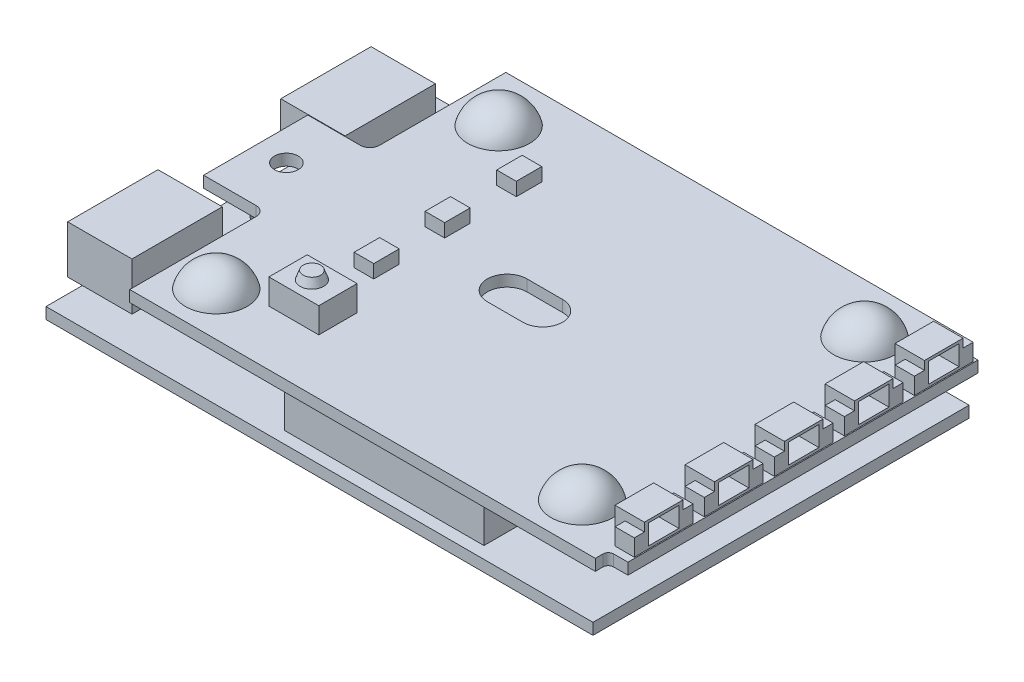
from build123d import *

# Parameters (mm, degrees)
SKETCH1_W                          = 77.978
SKETCH1_H                          = 53.6194
BOTTOM_BOARD_DEPTH                 = 1.6129
SKETCH2_W                          = 9.1694
SKETCH2_H                          = 12.8778
CONNECTOR_BODY_DEPTH               = 6.8199
SKETCH4_W                          = 2.6289
SKETCH4_H                          = 2.5908
CONNECTOR_HOLES_DEPTH              = 5.08
BOTTOM_BOARD_HOLE_REACH            = 96.88
SKETCH5_R                          = 1.69545
SKETCH5_R_2                        = 3.048
SKETCH6_W                          = 28.448
SKETCH6_H                          = 5.5626
LAYER_CONNECTORS_DEPTH             = 6.4516
SKETCH7_R                          = 1.69545
TOP_BOARD_DEPTH                    = 1.6129
SKETCH8_W                          = 2.7432
SKETCH8_H                          = 8.382
MAKER_CONNECTOR_SIDES_DEPTH        = 2.3876
SKETCH9_W                          = 4.191
SKETCH9_H                          = 5.5118
MARKER_CONNECTOR_BOX_DEPTH         = 1.2192
MARKER_CONNECTOR_REAR_REACH        = 99.705
SKETCH10_W                         = 1.4478
SKETCH10_H                         = 5.5118
SKETCH11_W                         = 4.318
SKETCH11_H                         = 2.8448
MARKER_CONNECTOR_DEPTH             = 3.175
MAKER_CONNECTORS_PATTERN_COUNT     = 5
MAKER_CONNECTORS_PATTERN_PITCH     = 9.9822
SKETCH12_R                         = 4.4069
GLUE_DOME_DEPTH                    = 3.4036
GLUE_DOME_FILLET_R                 = 4.54152
GLUE_PATTERN_COUNT                 = 2
GLUE_PATTERN_PITCH                 = 40.259
GLUE_PATTERN_COUNT_DIR2            = 2
GLUE_PATTERN_PITCH_DIR2            = 52.1462
GLUE_DOME_FILLET_OF_GLUE_PATTERN_R = 4.54152
SKETCH13_W                         = 2.794
SKETCH13_H                         = 3.6322
LEDS_DEPTH                         = 1.905
SKETCH14_W                         = 7.112
SKETCH14_H                         = 5.461
IR_RECEIVER_BASE_DEPTH             = 3.6068
SKETCH16_R                         = 1.6764
SKETCH17_R                         = 1.2446
SKETCH18_W                         = 2.794
SKETCH18_H                         = 5.0292
BACK_COMPONENTS_DEPTH              = 2.4892
SKETCH19_W                         = 1.778
SKETCH19_H                         = 3.0734
BOTTOM_CAPS_DEPTH                  = 1.7526


with BuildPart() as part:
    # Sketch1 → Bottom Board (new body)
    with BuildSketch(Plane(origin=(0, 0, 0), x_dir=(1, 0, 0), z_dir=(0, 1, 0))):
        with Locations((38.989, -26.8097)):
            Rectangle(SKETCH1_W, SKETCH1_H)
    extrude(amount=BOTTOM_BOARD_DEPTH)

    # Sketch2 → Connector Body (add)
    with BuildSketch(Plane(origin=(0, 1.6129, 0), x_dir=(-1, 0, 0), z_dir=(0, 1, 0))):
        with Locations((-2.4892, 11.6205)):
            Rectangle(SKETCH2_W, SKETCH2_H)
    connector_body = extrude(amount=CONNECTOR_BODY_DEPTH)

    # Sketch4 → Connector Holes (cut)
    with BuildSketch(Plane.ZY.offset(2.0955)):
        with Locations((7.08025, 6.5151)):
            Rectangle(SKETCH4_W, SKETCH4_H)
        with Locations((10.107083333, 6.5151)):
            Rectangle(SKETCH4_W, SKETCH4_H)
        with Locations((13.133916667, 6.5151)):
            Rectangle(SKETCH4_W, SKETCH4_H)
        with Locations((16.16075, 6.5151)):
            Rectangle(SKETCH4_W, SKETCH4_H)
        with Locations((16.16075, 3.5306)):
            Rectangle(SKETCH4_W, SKETCH4_H)
        with Locations((13.133916667, 3.5306)):
            Rectangle(SKETCH4_W, SKETCH4_H)
        with Locations((10.107083333, 3.5306)):
            Rectangle(SKETCH4_W, SKETCH4_H)
        with Locations((7.08025, 3.5306)):
            Rectangle(SKETCH4_W, SKETCH4_H)
    connector_holes = extrude(amount=-CONNECTOR_HOLES_DEPTH, mode=Mode.SUBTRACT)

    # Connector Mirror: Connector Body, Connector Holes across plane
    add(connector_body.mirror(Plane(origin=(0, 0, 26.8097), x_dir=(1, 0, 0), z_dir=(0, 0, -1))))
    add(connector_holes.mirror(Plane(origin=(0, 0, 26.8097), x_dir=(1, 0, 0), z_dir=(0, 0, -1))), mode=Mode.SUBTRACT)

    # Sketch5 → Bottom Board Hole (cut, up to next)
    with BuildSketch(Plane(origin=(0, 1.6129, 0), x_dir=(1, 0, 0), z_dir=(0, 1, 0)), mode=Mode.PRIVATE) as bottom_board_hole_sk1:
        with Locations(Location((4.67995, -26.8097, 0), (0, 0, 270))):
            Circle(SKETCH5_R)
    bottom_board_hole_tool1 = extrude(bottom_board_hole_sk1.sketch, amount=-BOTTOM_BOARD_HOLE_REACH, mode=Mode.PRIVATE) & part.part
    # Sketch5 → Bottom Board Hole (cut, up to next)
    with BuildSketch(Plane(origin=(0, 1.6129, 0), x_dir=(1, 0, 0), z_dir=(0, 1, 0)), mode=Mode.PRIVATE) as bottom_board_hole_sk2:
        with Locations(Location((39.0652, -26.8097, 0), (0, 0, 270))):
            Circle(SKETCH5_R_2)
    bottom_board_hole_tool2 = extrude(bottom_board_hole_sk2.sketch, amount=-BOTTOM_BOARD_HOLE_REACH, mode=Mode.PRIVATE) & part.part
    add(bottom_board_hole_tool1.solids().sort_by_distance((4.67995, 1.6129, 26.8097))[0], mode=Mode.SUBTRACT)
    add(bottom_board_hole_tool2.solids().sort_by_distance((39.0652, 1.6129, 26.8097))[0], mode=Mode.SUBTRACT)

    # Sketch6 → Layer Connectors (add)
    with BuildSketch(Plane(origin=(0, 1.6129, 0), x_dir=(-1, 0, 0), z_dir=(0, 1, 0))):
        with Locations((-53.594, 4.4831)):
            Rectangle(SKETCH6_W, SKETCH6_H)
        with Locations((-46.5074, 49.1363)):
            Rectangle(SKETCH6_W, SKETCH6_H)
    extrude(amount=LAYER_CONNECTORS_DEPTH)

    # Sketch7 → Top Board (add)
    with BuildSketch(Plane(origin=(0, 8.0645, 0), x_dir=(1, 0, 0), z_dir=(0, 1, 0))):
        with BuildLine():
            Line((78.3082, 0), (11.938, 0))
            Line((11.938, 0), (11.938, -18.0086))
            ThreePointArc((11.938, -18.0086), (11.536267661, -18.978467661), (10.5664, -19.3802))
            Line((10.5664, -19.3802), (3.0861, -19.3802))
            Line((3.0861, -19.3802), (3.0861, -34.2392))
            Line((3.0861, -34.2392), (10.5664, -34.2392))
            ThreePointArc((10.5664, -34.2392), (11.536267661, -34.640932339), (11.938, -35.6108))
            Line((11.938, -35.6108), (11.938, -53.6194))
            Line((11.938, -53.6194), (78.3082, -53.6194))
            Line((78.3082, -53.6194), (78.3082, -52.5272))
            ThreePointArc((78.3082, -52.5272), (78.531384633, -51.988384633), (79.0702, -51.7652))
            Line((79.0702, -51.7652), (81.1022, -51.7652))
            Line((81.1022, -51.7652), (81.1022, -1.8542))
            Line((81.1022, -1.8542), (79.0702, -1.8542))
            ThreePointArc((79.0702, -1.8542), (78.531384633, -1.631015367), (78.3082, -1.0922))
            Line((78.3082, -1.0922), (78.3082, 0))
        make_face()
        with Locations(Location((7.46125, -26.8097, 0), (0, 0, 270))):
            Circle(SKETCH7_R, mode=Mode.SUBTRACT)
        with BuildLine():
            Line((38.93185, -23.98395), (43.99915, -23.98395))
            ThreePointArc((43.99915, -23.98395), (46.8249, -26.8097), (43.99915, -29.63545))
            Line((43.99915, -29.63545), (38.93185, -29.63545))
            ThreePointArc((38.93185, -29.63545), (36.1061, -26.8097), (38.93185, -23.98395))
        make_face(mode=Mode.SUBTRACT)
    extrude(amount=TOP_BOARD_DEPTH)

    # Sketch8 → Maker Connector Sides (add)
    with BuildSketch(Plane(origin=(0, 9.6774, 0), x_dir=(1, 0, 0), z_dir=(0, 1, 0))):
        with Locations((79.5782, -6.5786)):
            Rectangle(SKETCH8_W, SKETCH8_H)
    maker_connector_sides = extrude(amount=MAKER_CONNECTOR_SIDES_DEPTH)

    # Sketch9 → Marker Connector Box (add)
    with BuildSketch(Plane(origin=(0, 12.065, 0), x_dir=(1, 0, 0), z_dir=(0, 1, 0))):
        with Locations((78.8543, -6.5786)):
            Rectangle(SKETCH9_W, SKETCH9_H)
    marker_connector_box = extrude(amount=MARKER_CONNECTOR_BOX_DEPTH)

    # Sketch10 → Marker Connector Rear (add, up to next)
    with BuildSketch(Plane(origin=(0, 9.6774, 0), x_dir=(1, 0, 0), z_dir=(0, 1, 0)), mode=Mode.PRIVATE) as marker_connector_rear_sk1:
        with Locations((77.4827, -6.5786)):
            Rectangle(SKETCH10_W, SKETCH10_H)
    marker_connector_rear_tool1 = extrude(marker_connector_rear_sk1.sketch, amount=MARKER_CONNECTOR_REAR_REACH, mode=Mode.PRIVATE) - part.part
    marker_connector_rear = marker_connector_rear_tool1.solids().sort_by_distance((77.4827, 9.6774, 6.5786))[0]
    add(marker_connector_rear)

    # Sketch11 → Marker Connector (cut)
    with BuildSketch(Plane(origin=(81.1022, 0, 0), x_dir=(0, 0, -1), z_dir=(1, 0, 0))):
        with Locations((-6.5786, 11.4808)):
            Rectangle(SKETCH11_W, SKETCH11_H)
    marker_connector = extrude(amount=-MARKER_CONNECTOR_DEPTH, mode=Mode.SUBTRACT)

    # Maker Connectors Pattern: Maker Connector Sides, Marker Connector Box, Marker Connector Rear, Marker Connector ×5
    with Locations(*[(0, 0, i * MAKER_CONNECTORS_PATTERN_PITCH) for i in range(1, MAKER_CONNECTORS_PATTERN_COUNT)]):
        add(maker_connector_sides)
        add(marker_connector_box)
        add(marker_connector_rear)
        add(marker_connector, mode=Mode.SUBTRACT)

    # Sketch12 → Glue Dome (add)
    with BuildSketch(Plane(origin=(0, 9.6774, 0), x_dir=(-1, 0, 0), z_dir=(0, 1, 0))):
        with Locations(Location((-17.9959, 7.0866, 0), (0, 0, 270))):
            Circle(SKETCH12_R)
    glue_dome = extrude(amount=GLUE_DOME_DEPTH)

    # Glue Dome Fillet
    # the kernel refuses this fillet: 4.54152 mm, written as the material it takes off along each edge
    with BuildSketch(Plane(origin=(17.9959, 13.081, 7.0866), x_dir=(0, 0, -1), z_dir=(1, 0, 0))) as glue_dome_fillet_piece_1:
        with BuildLine():
            CenterArc((0.010248776, -4.54152), GLUE_DOME_FILLET_R, 14.510610197, 75.489389803)
            Line((0.010248776, 0), (0.010248776, 0.0908304))
            Line((0.010248776, 0.0908304), (4.4069, 0.0908304))
            Line((4.4069, 0.0908304), (4.4977304, 0))
            ThreePointArc((4.4977304, 0), (4.4977304, -1.7018), (4.494833024, -3.3808416))
            Line((4.494833024, -3.3808416), (4.4069, -3.4036))
        make_face()
    revolve(axis=Axis((17.9959, 13.081, 7.0866), (0, 1, 0)), mode=Mode.SUBTRACT)

    # Glue pattern: Glue Dome 2 × 2
    with Locations(*[(j * GLUE_PATTERN_PITCH_DIR2, 0, i * GLUE_PATTERN_PITCH) for i in range(GLUE_PATTERN_COUNT) for j in range(GLUE_PATTERN_COUNT_DIR2) if (i, j) != (0, 0)]):
        add(glue_dome)

    # Glue Dome Fillet of Glue pattern
    # the kernel refuses this fillet: 4.54152 mm, written as the material it takes off along each edge
    with BuildSketch(Plane(origin=(70.1421, 13.081, 7.0866), x_dir=(0, 0, -1), z_dir=(1, 0, 0))) as glue_dome_fillet_of_glue_pattern_piece_1:
        with BuildLine():
            CenterArc((0.010248776, -4.54152), GLUE_DOME_FILLET_OF_GLUE_PATTERN_R, 14.510610197, 75.489389803)
            Line((0.010248776, 0), (0.010248776, 0.0908304))
            Line((0.010248776, 0.0908304), (4.4069, 0.0908304))
            Line((4.4069, 0.0908304), (4.4977304, 0))
            ThreePointArc((4.4977304, 0), (4.4977304, -1.7018), (4.494833024, -3.3808416))
            Line((4.494833024, -3.3808416), (4.4069, -3.4036))
        make_face()
    revolve(axis=Axis((70.1421, 13.081, 7.0866), (0, 1, 0)), mode=Mode.SUBTRACT)
    with BuildSketch(Plane(origin=(17.9959, 13.081, 47.3456), x_dir=(0, 0, -1), z_dir=(1, 0, 0))) as glue_dome_fillet_of_glue_pattern_piece_2:
        with BuildLine():
            CenterArc((0.010248776, -4.54152), GLUE_DOME_FILLET_OF_GLUE_PATTERN_R, 14.510610197, 75.489389803)
            Line((0.010248776, 0), (0.010248776, 0.0908304))
            Line((0.010248776, 0.0908304), (4.4069, 0.0908304))
            Line((4.4069, 0.0908304), (4.4977304, 0))
            ThreePointArc((4.4977304, 0), (4.4977304, -1.7018), (4.494833024, -3.3808416))
            Line((4.494833024, -3.3808416), (4.4069, -3.4036))
        make_face()
    revolve(axis=Axis((17.9959, 13.081, 47.3456), (0, 1, 0)), mode=Mode.SUBTRACT)
    with BuildSketch(Plane(origin=(70.1421, 13.081, 47.3456), x_dir=(0, 0, -1), z_dir=(1, 0, 0))) as glue_dome_fillet_of_glue_pattern_piece_3:
        with BuildLine():
            CenterArc((0.010248776, -4.54152), GLUE_DOME_FILLET_OF_GLUE_PATTERN_R, 14.510610197, 75.489389803)
            Line((0.010248776, 0), (0.010248776, 0.0908304))
            Line((0.010248776, 0.0908304), (4.4069, 0.0908304))
            Line((4.4069, 0.0908304), (4.4977304, 0))
            ThreePointArc((4.4977304, 0), (4.4977304, -1.7018), (4.494833024, -3.3808416))
            Line((4.494833024, -3.3808416), (4.4069, -3.4036))
        make_face()
    revolve(axis=Axis((70.1421, 13.081, 47.3456), (0, 1, 0)), mode=Mode.SUBTRACT)

    # Sketch13 → LEDs (add)
    with BuildSketch(Plane(origin=(0, 9.6774, 0), x_dir=(-1, 0, 0), z_dir=(0, 1, 0))):
        with Locations((-26.6319, 12.7889)):
            Rectangle(SKETCH13_W, SKETCH13_H)
        with Locations((-26.6319, 22.9997)):
            Rectangle(SKETCH13_W, SKETCH13_H)
        with Locations((-26.6319, 33.1089)):
            Rectangle(SKETCH13_W, SKETCH13_H)
    extrude(amount=LEDS_DEPTH)

    # Sketch14 → IR receiver base (add)
    with BuildSketch(Plane(origin=(0, 9.6774, 0), x_dir=(-1, 0, 0), z_dir=(0, 1, 0))):
        with Locations((-27.4574, 43.0149)):
            Rectangle(SKETCH14_W, SKETCH14_H)
    extrude(amount=IR_RECEIVER_BASE_DEPTH)

    # Sketch16 → IR receiver section 0
    with BuildSketch(Plane(origin=(0, 13.2842, 0), x_dir=(-1, 0, 0), z_dir=(0, 1, 0))):
        with Locations((-27.305, 43.0149)):
            Circle(SKETCH16_R)
    # Sketch17 → IR receiver section 1
    with BuildSketch(Plane(origin=(0, 14.4526, 0), x_dir=(-1, 0, 0), z_dir=(0, 1, 0))):
        with Locations((-27.305, 43.0149)):
            Circle(SKETCH17_R)
    loft()

    # Sketch18 → Back components (add)
    with BuildSketch(Plane.XZ):
        with Locations((16.6878, 47.0408)):
            Rectangle(SKETCH18_W, SKETCH18_H)
        with Locations((16.6878, 40.2082)):
            Rectangle(SKETCH18_W, SKETCH18_H)
        with Locations((21.717, 33.5788)):
            Rectangle(SKETCH18_W, SKETCH18_H)
    extrude(amount=BACK_COMPONENTS_DEPTH)

    # Sketch19 → Bottom caps (add)
    with BuildSketch(Plane.XZ):
        with Locations((37.1983, 42.0497)):
            Rectangle(SKETCH19_W, SKETCH19_H)
        with Locations((41.2496, 35.8013)):
            Rectangle(SKETCH19_W, SKETCH19_H)
    extrude(amount=BOTTOM_CAPS_DEPTH)


solid = part.part
